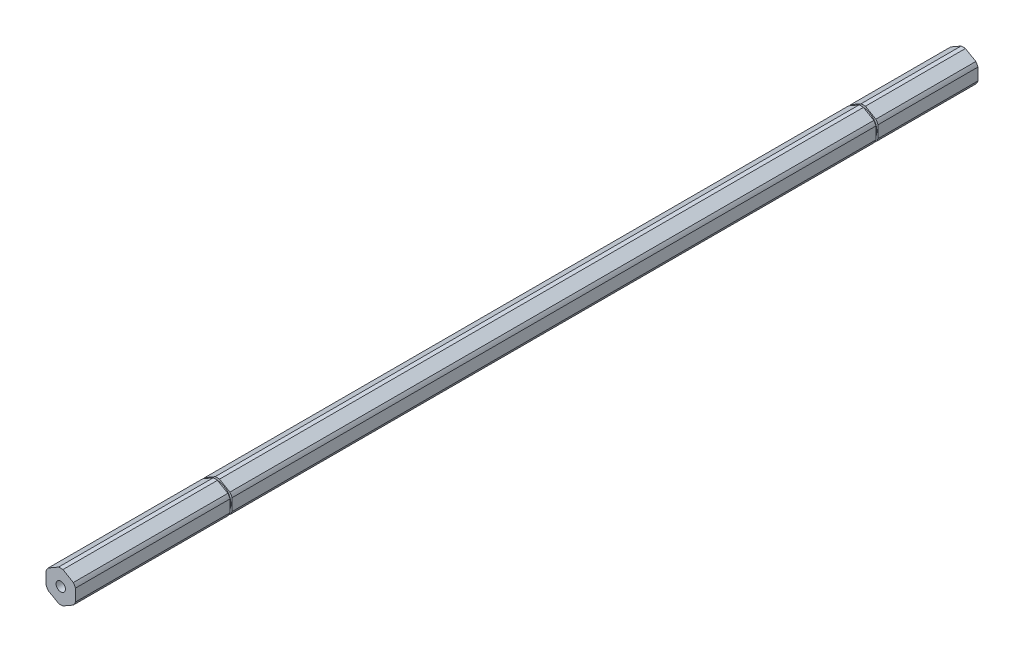
from build123d import *

# Parameters (mm, degrees)
BOSS_EXTRUDE1_DEPTH        = 194.32016
SKETCH2_R                  = 2.0193
CUT_EXTRUDE1_DEPTH         = 389.752688729
SKETCH4_W                  = 3.175
SKETCH4_H                  = 0.889
F_10_32_TAPPED_HOLE1_D     = 4.0386
F_10_32_TAPPED_HOLE1_DEPTH = 11.938
F_10_32_TAPPED_HOLE1_TIP   = 1.213317848


with BuildPart() as part:
    # Sketch1 → Boss-Extrude1 (new, symmetric)
    with BuildSketch(Plane.XY):
        with BuildLine():
            ThreePointArc((0.93173274, 6.79441227), (0, 6.858), (-0.93173274, 6.79441227))
            Line((-0.93173274, 6.79441227), (-5.41826726, 4.204110358))
            ThreePointArc((-5.41826726, 4.204110358), (-5.939202219, 3.429), (-6.35, 2.590301913))
            Line((-6.35, 2.590301913), (-6.35, -2.590301913))
            ThreePointArc((-6.35, -2.590301913), (-5.939202219, -3.429), (-5.41826726, -4.204110358))
            Line((-5.41826726, -4.204110358), (-0.93173274, -6.79441227))
            ThreePointArc((-0.93173274, -6.79441227), (0, -6.858), (0.93173274, -6.79441227))
            Line((0.93173274, -6.79441227), (5.41826726, -4.204110358))
            ThreePointArc((5.41826726, -4.204110358), (5.939202219, -3.429), (6.35, -2.590301913))
            Line((6.35, -2.590301913), (6.35, 2.590301913))
            ThreePointArc((6.35, 2.590301913), (5.939202219, 3.429), (5.41826726, 4.204110358))
            Line((5.41826726, 4.204110358), (0.93173274, 6.79441227))
        make_face()
    extrude(amount=BOSS_EXTRUDE1_DEPTH, both=True)

    # Sketch2 → Cut-Extrude1 (cut, through all)
    with BuildSketch(Plane.XY.offset(194.32016)):
        Circle(SKETCH2_R)
    extrude(amount=-CUT_EXTRUDE1_DEPTH, mode=Mode.SUBTRACT)

    # Sketch4 → Cut-Revolve4 (revolve, cut)
    with BuildSketch(Plane(origin=(0, 0, 0), x_dir=(1, 0, 0), z_dir=(0, 1, 0))):
        with Locations((7.4422, 150.82266)):
            Rectangle(SKETCH4_W, SKETCH4_H)
        with Locations((7.4422, -127.32766)):
            Rectangle(SKETCH4_W, SKETCH4_H)
    revolve(axis=Axis((0, 0, -194.32016), (0, 0, 1)), mode=Mode.SUBTRACT)

    # #10-32 Tapped Hole1
    with Locations(Plane.XY.offset(194.32016)):
        with Locations((0, 0)):
            Hole(F_10_32_TAPPED_HOLE1_D / 2, depth=F_10_32_TAPPED_HOLE1_DEPTH)
            with Locations((0, 0, -(F_10_32_TAPPED_HOLE1_DEPTH + F_10_32_TAPPED_HOLE1_TIP / 2))):  # 118° drill point
                Cone(0, F_10_32_TAPPED_HOLE1_D / 2, F_10_32_TAPPED_HOLE1_TIP, mode=Mode.SUBTRACT)


solid = part.part
